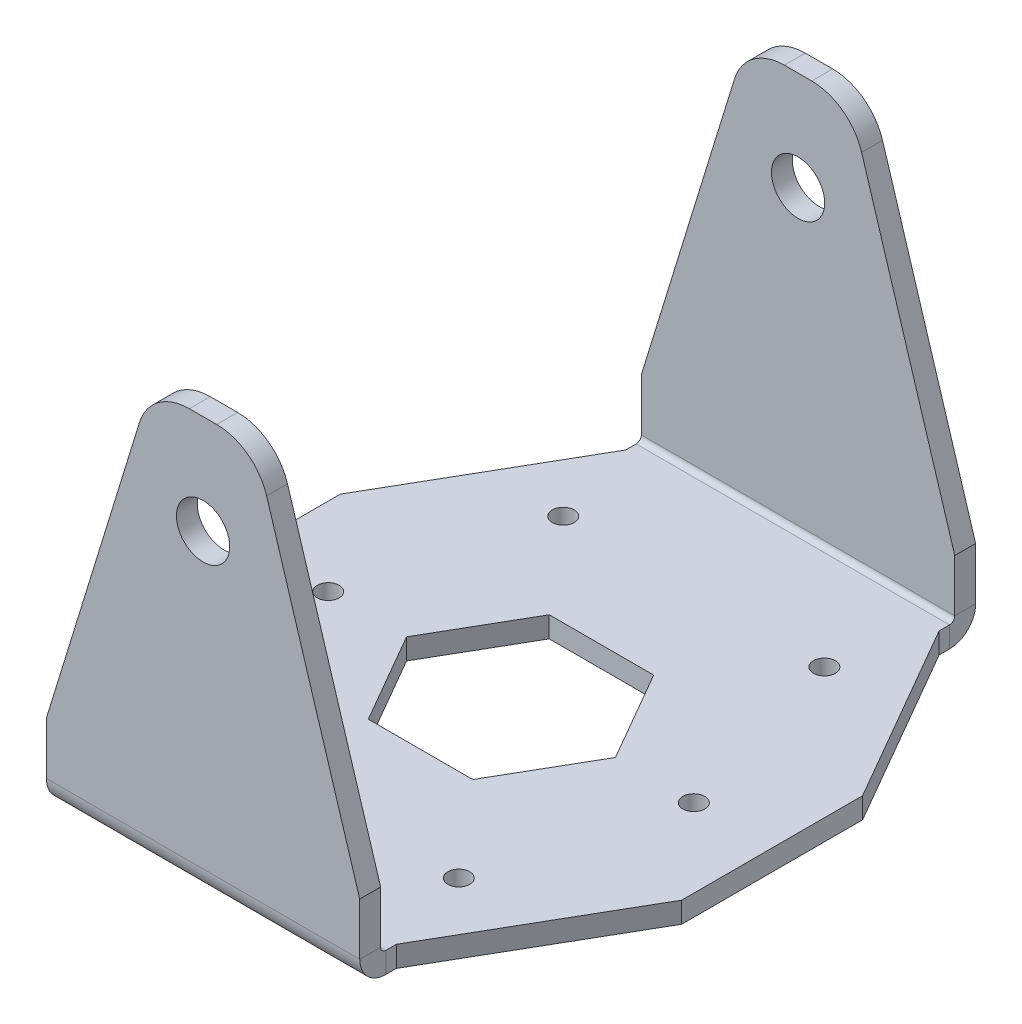
from build123d import *

# Parameters (mm, degrees)
EXTRUDE_1_DEPTH        = 3
SHEET_START            = -1
SHEET_METAL_1_DEPTH    = 1
SM_EDGE_FLANGE_1_DEPTH = 60
CUT_EXTRUDE_1_DEPTH    = 149.811702088
CUT_EXTRUDE_2_DEPTH    = 114.368696469
CUT_EXTRUDE_4_DEPTH    = 114.368696469
MIRROR_6_COPY_1_DEPTH  = 149.811702088
SKETCH_13_R            = 5.1
CUT_EXTRUDE_5_DEPTH    = 155.10011472
FILLET_1_R             = 10
CUT_EXTRUDE_6_REACH    = 110.409
SKETCH_15_R            = 2.1


# Read off the part's stored shape, not the designer's step: 轉換-實體1
# Sheet-metal steps are written as plain solids
with BuildPart() as part:
    # Sketch 1 → 填料-伸長1 (new body)
    with BuildSketch(Plane(origin=(0, 0, 0), x_dir=(1, 0, 0), z_dir=(0, 1, 0))):
        Polygon((30, 51.961524227), (-30, 51.961524227), (-60, 0), (-30, -51.961524227), (30, -51.961524227), (60, 0), align=None)
    extrude(amount=EXTRUDE_1_DEPTH)

    # Sheet Metal 1 outline → Sheet Metal 1 (add)
    with BuildSketch(Plane(origin=(0, 0, 0), x_dir=(1, 0, 0), z_dir=(0, 1, 0)).offset(SHEET_START)):
        Polygon((-30, 51.961524227), (-60, 0), (-30, -51.961524227), (30, -51.961524227), (60, 0), (30, 51.961524227), align=None)
    extrude(amount=SHEET_METAL_1_DEPTH)

    # 邊線-凸緣1 section (across the edge) → 邊線-凸緣1 (add)
    with BuildSketch(Plane(origin=(-30, 3, 54.961524227), x_dir=(0, 0, -1), z_dir=(1, 0, 0))):
        with BuildLine():
            Line((-4, 1), (-4, 76))
            Line((-4, 76), (0, 76))
            Line((0, 76), (0, 1))
            ThreePointArc((0, 1), (0.292893219, 0.292893219), (1, 0))
            Line((1, 0), (3, 0))
            Line((3, 0), (3, -4))
            Line((3, -4), (1, -4))
            ThreePointArc((1, -4), (-2.535533906, -2.535533906), (-4, 1))
        make_face()
    sm_edge_flange_1 = extrude(amount=SM_EDGE_FLANGE_1_DEPTH)

    # 草圖9 → 除料-伸長1 (cut, symmetric)
    with BuildSketch(Plane.XY.offset(58.961524227)):
        Polygon((-30, 79), (-30, 14), (-10, 79), align=None)
    cut_extrude_1 = extrude(amount=CUT_EXTRUDE_1_DEPTH, both=True, mode=Mode.SUBTRACT)

    # 草圖10 → 除料-伸長2 (cut, through all)
    with BuildSketch(Plane(origin=(0, 3, 0), x_dir=(1, 0, 0), z_dir=(0, 1, 0))):
        Polygon((10, 17.320508076), (-10, 17.320508076), (-20, 0), (-10, -17.320508076), (10, -17.320508076), (20, 0), align=None)
    extrude(amount=-CUT_EXTRUDE_2_DEPTH, mode=Mode.SUBTRACT)

    # 草圖12 → 除料-伸長4 (cut, symmetric)
    with BuildSketch(Plane(origin=(0, 3, 0), x_dir=(1, 0, 0), z_dir=(0, 1, 0))):
        Polygon((50, 295.043861202), (50, 17.320508076), (50, -17.320508076), (50, -295.043861202), (605.446706252, -295.043861202), (605.446706252, 295.043861202), align=None)
    cut_extrude_4 = extrude(amount=CUT_EXTRUDE_4_DEPTH, both=True, mode=Mode.SUBTRACT)

    # 鏡射1: 除料-伸長1 across plane
    add(cut_extrude_1.mirror(Plane(origin=(0, 0, 0), x_dir=(0, 0, 1), z_dir=(1, 0, 0))), mode=Mode.SUBTRACT)

    # 鏡射6: 邊線-凸緣1, 除料-伸長1 across plane
    add(sm_edge_flange_1.mirror(Plane.XY))
    add(cut_extrude_1.mirror(Plane.XY), mode=Mode.SUBTRACT)

    # 鏡射6 copy 1 sketch → 鏡射6 copy 1 (cut, symmetric)
    with BuildSketch(Plane(origin=(0, 0, -58.961524227), x_dir=(-1, 0, 0), z_dir=(0, 0, -1))):
        Polygon((-30, 79), (-30, 14), (-10, 79), align=None)
    extrude(amount=MIRROR_6_COPY_1_DEPTH, both=True, mode=Mode.SUBTRACT)

    # 草圖13 → 除料-伸長5 (cut, through all)
    with BuildSketch(Plane.XY.offset(58.961524227)):
        with Locations((0, 60)):
            Circle(SKETCH_13_R)
    extrude(amount=-CUT_EXTRUDE_5_DEPTH, mode=Mode.SUBTRACT)

    # 圓角1
    fillet_1_edges = [part.edges().sort_by_distance(p)[0] for p in [
        (10, 79, 56.961524227),
        (10, 79, -56.961524227),
        (-10, 79, -56.961524227),
        (-10, 79, 56.961524227),
    ]]
    fillet(fillet_1_edges, radius=FILLET_1_R)

    # 鏡射7: 除料-伸長4 across plane
    add(cut_extrude_4.mirror(Plane(origin=(0, 0, 0), x_dir=(0, 0, 1), z_dir=(1, 0, 0))), mode=Mode.SUBTRACT)

    # 草圖15 → 除料-伸長6 (cut, up to next)
    with BuildSketch(Plane(origin=(0, 3, 0), x_dir=(1, 0, 0), z_dir=(0, 1, 0)), mode=Mode.PRIVATE) as cut_extrude_6_sk1:
        with Locations(Location((-35, 0, 0), (0, 0, 270))):
            Circle(SKETCH_15_R)
    cut_extrude_6_tool1 = extrude(cut_extrude_6_sk1.sketch, amount=-CUT_EXTRUDE_6_REACH, mode=Mode.PRIVATE) & part.part
    # 草圖15 → 除料-伸長6 (cut, up to next)
    with BuildSketch(Plane(origin=(0, 3, 0), x_dir=(1, 0, 0), z_dir=(0, 1, 0)), mode=Mode.PRIVATE) as cut_extrude_6_sk2:
        with Locations(Location((-25, 35, 0), (0, 0, 270))):
            Circle(SKETCH_15_R)
    cut_extrude_6_tool2 = extrude(cut_extrude_6_sk2.sketch, amount=-CUT_EXTRUDE_6_REACH, mode=Mode.PRIVATE) & part.part
    # 草圖15 → 除料-伸長6 (cut, up to next)
    with BuildSketch(Plane(origin=(0, 3, 0), x_dir=(1, 0, 0), z_dir=(0, 1, 0)), mode=Mode.PRIVATE) as cut_extrude_6_sk3:
        with Locations(Location((25, 35, 0), (0, 0, 270))):
            Circle(SKETCH_15_R)
    cut_extrude_6_tool3 = extrude(cut_extrude_6_sk3.sketch, amount=-CUT_EXTRUDE_6_REACH, mode=Mode.PRIVATE) & part.part
    # 草圖15 → 除料-伸長6 (cut, up to next)
    with BuildSketch(Plane(origin=(0, 3, 0), x_dir=(1, 0, 0), z_dir=(0, 1, 0)), mode=Mode.PRIVATE) as cut_extrude_6_sk4:
        with Locations(Location((25, -35, 0), (0, 0, 270))):
            Circle(SKETCH_15_R)
    cut_extrude_6_tool4 = extrude(cut_extrude_6_sk4.sketch, amount=-CUT_EXTRUDE_6_REACH, mode=Mode.PRIVATE) & part.part
    # 草圖15 → 除料-伸長6 (cut, up to next)
    with BuildSketch(Plane(origin=(0, 3, 0), x_dir=(1, 0, 0), z_dir=(0, 1, 0)), mode=Mode.PRIVATE) as cut_extrude_6_sk5:
        with Locations(Location((-25, -35, 0), (0, 0, 270))):
            Circle(SKETCH_15_R)
    cut_extrude_6_tool5 = extrude(cut_extrude_6_sk5.sketch, amount=-CUT_EXTRUDE_6_REACH, mode=Mode.PRIVATE) & part.part
    # 草圖15 → 除料-伸長6 (cut, up to next)
    with BuildSketch(Plane(origin=(0, 3, 0), x_dir=(1, 0, 0), z_dir=(0, 1, 0)), mode=Mode.PRIVATE) as cut_extrude_6_sk6:
        with Locations(Location((35, 0, 0), (0, 0, 270))):
            Circle(SKETCH_15_R)
    cut_extrude_6_tool6 = extrude(cut_extrude_6_sk6.sketch, amount=-CUT_EXTRUDE_6_REACH, mode=Mode.PRIVATE) & part.part
    add(cut_extrude_6_tool1.solids().sort_by_distance((-35, 3, 0))[0], mode=Mode.SUBTRACT)
    add(cut_extrude_6_tool2.solids().sort_by_distance((-25, 3, -35))[0], mode=Mode.SUBTRACT)
    add(cut_extrude_6_tool3.solids().sort_by_distance((25, 3, -35))[0], mode=Mode.SUBTRACT)
    add(cut_extrude_6_tool4.solids().sort_by_distance((25, 3, 35))[0], mode=Mode.SUBTRACT)
    add(cut_extrude_6_tool5.solids().sort_by_distance((-25, 3, 35))[0], mode=Mode.SUBTRACT)
    add(cut_extrude_6_tool6.solids().sort_by_distance((35, 3, 0))[0], mode=Mode.SUBTRACT)


solid = part.part
